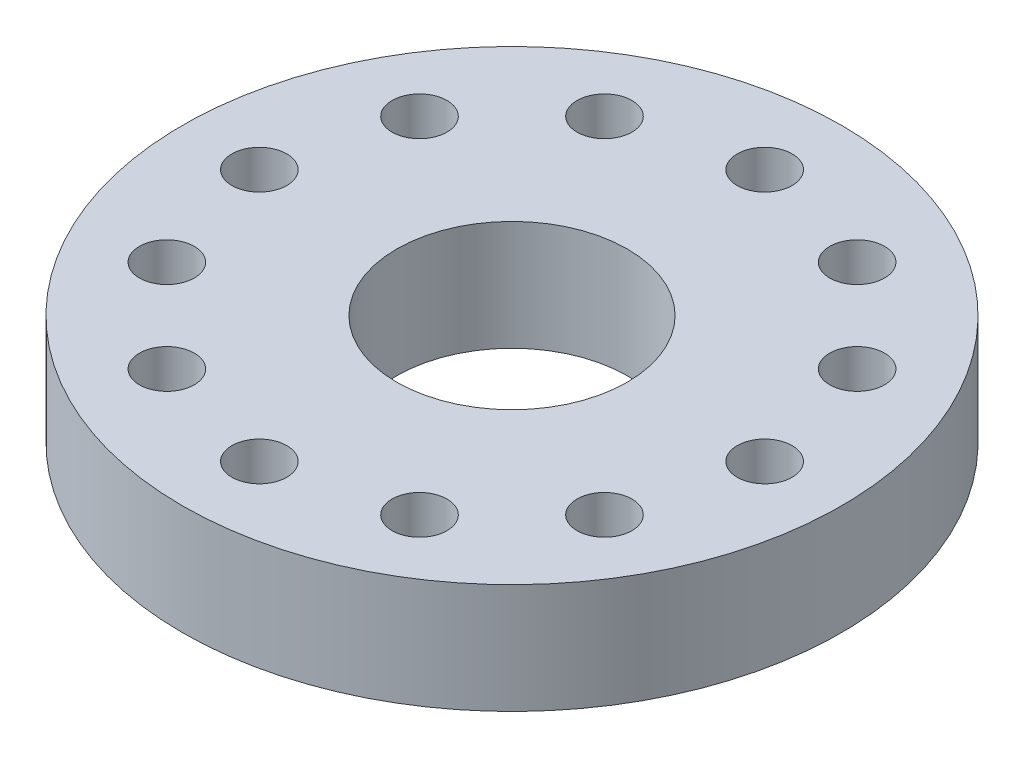
from build123d import *

# Parameters (mm, degrees)
SKETCH1_R           = 30
SKETCH1_R_2         = 2.5
SKETCH1_R_3         = 10.5
BOSS_EXTRUDE1_DEPTH = 10


with BuildPart() as part:
    # Sketch1 → Boss-Extrude1 (new body)
    with BuildSketch(Plane(origin=(0, 0, 0), x_dir=(1, 0, 0), z_dir=(0, 1, 0))):
        Circle(SKETCH1_R)
        with Locations((0, 23)):
            Circle(SKETCH1_R_2, mode=Mode.SUBTRACT)
        with Locations((11.5, 19.918584287)):
            Circle(SKETCH1_R_2, mode=Mode.SUBTRACT)
        with Locations((19.918584287, 11.5)):
            Circle(SKETCH1_R_2, mode=Mode.SUBTRACT)
        with Locations((23, 0)):
            Circle(SKETCH1_R_2, mode=Mode.SUBTRACT)
        with Locations((19.918584287, -11.5)):
            Circle(SKETCH1_R_2, mode=Mode.SUBTRACT)
        with Locations((11.5, -19.918584287)):
            Circle(SKETCH1_R_2, mode=Mode.SUBTRACT)
        Circle(SKETCH1_R_3, mode=Mode.SUBTRACT)
        with Locations((0, -23)):
            Circle(SKETCH1_R_2, mode=Mode.SUBTRACT)
        with Locations((-11.5, -19.918584287)):
            Circle(SKETCH1_R_2, mode=Mode.SUBTRACT)
        with Locations((-19.918584287, -11.5)):
            Circle(SKETCH1_R_2, mode=Mode.SUBTRACT)
        with Locations((-23, 0)):
            Circle(SKETCH1_R_2, mode=Mode.SUBTRACT)
        with Locations((-19.918584287, 11.5)):
            Circle(SKETCH1_R_2, mode=Mode.SUBTRACT)
        with Locations((-11.5, 19.918584287)):
            Circle(SKETCH1_R_2, mode=Mode.SUBTRACT)
    extrude(amount=BOSS_EXTRUDE1_DEPTH)


solid = part.part
